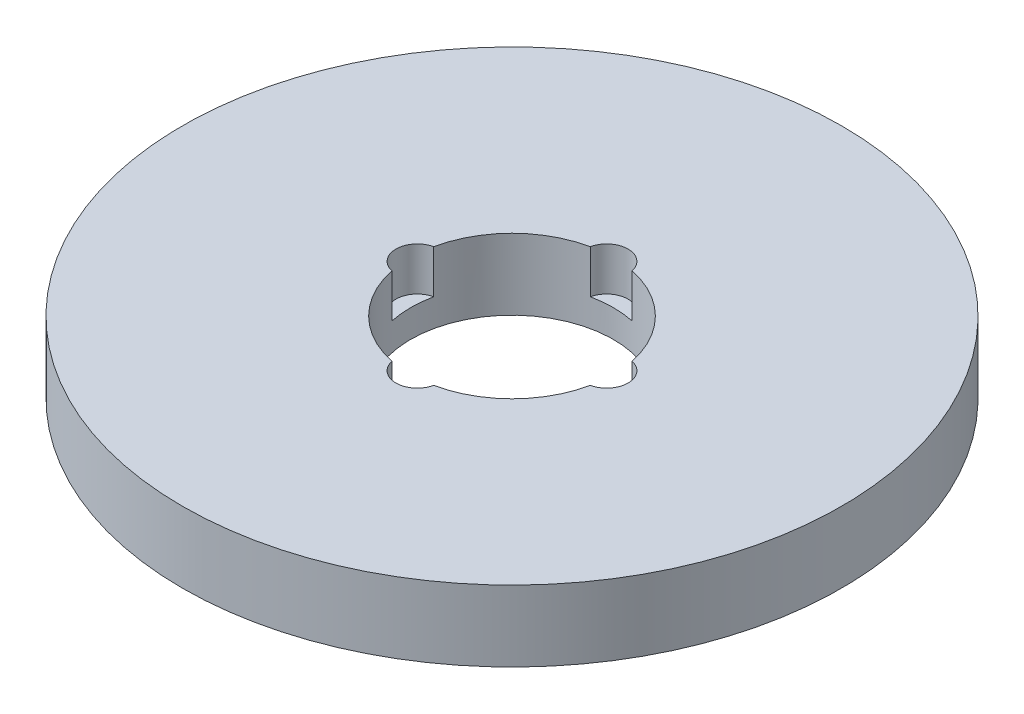
from build123d import *

# Parameters (mm, degrees)
SKETCH1_R           = 32.5
BOSS_EXTRUDE1_DEPTH = 7
SKETCH2_R           = 10
CUT_EXTRUDE1_DEPTH  = 47.491934784
SKETCH3_R           = 2.109451552
CUT_EXTRUDE2_DEPTH  = 4.281738984
CIRPATTERN1_COUNT   = 4


with BuildPart() as part:
    # Sketch1 → Boss-Extrude1 (new body)
    with BuildSketch(Plane(origin=(0, 0, 0), x_dir=(1, 0, 0), z_dir=(0, 1, 0))):
        Circle(SKETCH1_R)
    extrude(amount=BOSS_EXTRUDE1_DEPTH)

    # Sketch2 → Cut-Extrude1 (cut, through all)
    with BuildSketch(Plane(origin=(0, 0, 0), x_dir=(1, 0, 0), z_dir=(0, 1, 0))):
        Circle(SKETCH2_R)
    extrude(amount=CUT_EXTRUDE1_DEPTH, mode=Mode.SUBTRACT)

    # Sketch3 → Cut-Extrude2 (cut)
    with BuildSketch(Plane(origin=(0, 7, 0), x_dir=(1, 0, 0), z_dir=(0, 1, 0))):
        with Locations((-9.336876644, 0)):
            Circle(SKETCH3_R)
    cut_extrude2 = extrude(amount=-CUT_EXTRUDE2_DEPTH, mode=Mode.SUBTRACT)

    # CirPattern1: Cut-Extrude2 ×4 about axis
    cirpattern1_axis = Axis((0, 0, 0), (0, 1, 0))
    for i in range(1, CIRPATTERN1_COUNT):
        add(cut_extrude2.rotate(cirpattern1_axis, i * 360 / CIRPATTERN1_COUNT), mode=Mode.SUBTRACT)


solid = part.part
